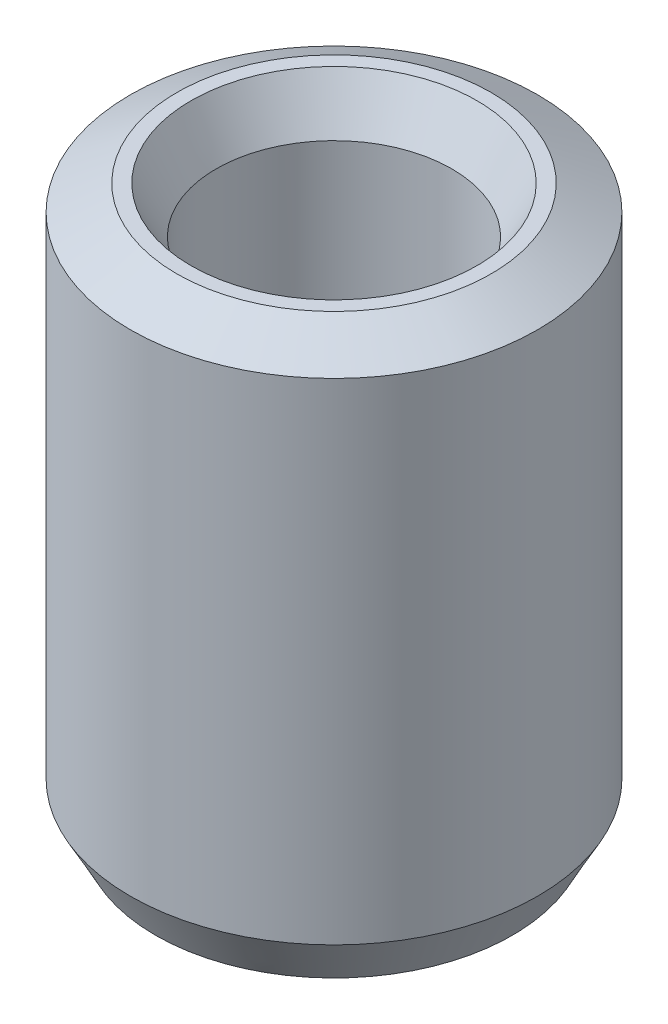
from build123d import *
from OCP.BRepFilletAPI import BRepFilletAPI_MakeChamfer

# Parameters (mm, degrees)
SKETCH1_R           = 30
BOSS_EXTRUDE1_DEPTH = 82.837790876
SKETCH2_R           = 17.359603472
CUT_EXTRUDE1_DEPTH  = 94.070401295
CHAMFER1_SIZE       = 3.709181736
CHAMFER1_SIZE2      = 6.845038756


with BuildPart() as part:
    # Sketch1 → Boss-Extrude1 (new body)
    with BuildSketch(Plane(origin=(0, 0, 0), x_dir=(1, 0, 0), z_dir=(0, 1, 0))):
        Circle(SKETCH1_R)
    extrude(amount=BOSS_EXTRUDE1_DEPTH)

    # Sketch2 → Cut-Extrude1 (cut, through all)
    with BuildSketch(Plane(origin=(0, 0, 0), x_dir=(1, 0, 0), z_dir=(0, 1, 0))):
        Circle(SKETCH2_R)
    extrude(amount=CUT_EXTRUDE1_DEPTH, mode=Mode.SUBTRACT)

    # Chamfer1: one chamfer whose edges measure the first distance from different faces: ONE call of the kernel's chamfer builder (chamfer() names one face for all edges)
    chamfer1_edges_1 = [part.edges().sort_by_distance(p)[0] for p in [
        (-17.359603472, 82.837790876, 0),
    ]]
    chamfer1_side_1 = [part.faces().sort_by_distance(p)[0] for p in [
        (-29.151471863, 82.837790876, 0),
    ]]
    chamfer1_edges_2 = [part.edges().sort_by_distance(p)[0] for p in [
        (-17.359603472, 0, 0),
    ]]
    chamfer1_side_2 = [part.faces().sort_by_distance(p)[0] for p in [
        (-17.359603472, 41.418895438, 0),
    ]]
    chamfer1_edges_3 = [part.edges().sort_by_distance(p)[0] for p in [
        (-30, 0, 0),
    ]]
    chamfer1_side_3 = [part.faces().sort_by_distance(p)[0] for p in [
        (-29.151471863, 0, 0),
    ]]
    chamfer1_edges_4 = [part.edges().sort_by_distance(p)[0] for p in [
        (-30, 82.837790876, 0),
    ]]
    chamfer1_side_4 = [part.faces().sort_by_distance(p)[0] for p in [
        (-30, 41.418895438, 0),
    ]]
    chamfer1 = BRepFilletAPI_MakeChamfer(part.part.solid().wrapped)
    for e in chamfer1_edges_1:
        chamfer1.Add(CHAMFER1_SIZE, CHAMFER1_SIZE2, e.wrapped, chamfer1_side_1[0].wrapped)  # the first distance lies on this face
    for e in chamfer1_edges_2:
        chamfer1.Add(CHAMFER1_SIZE, CHAMFER1_SIZE2, e.wrapped, chamfer1_side_2[0].wrapped)  # the first distance lies on this face
    for e in chamfer1_edges_3:
        chamfer1.Add(CHAMFER1_SIZE, CHAMFER1_SIZE2, e.wrapped, chamfer1_side_3[0].wrapped)  # the first distance lies on this face
    for e in chamfer1_edges_4:
        chamfer1.Add(CHAMFER1_SIZE, CHAMFER1_SIZE2, e.wrapped, chamfer1_side_4[0].wrapped)  # the first distance lies on this face
    add(Compound.cast(chamfer1.Shape()), mode=Mode.REPLACE)


solid = part.part
